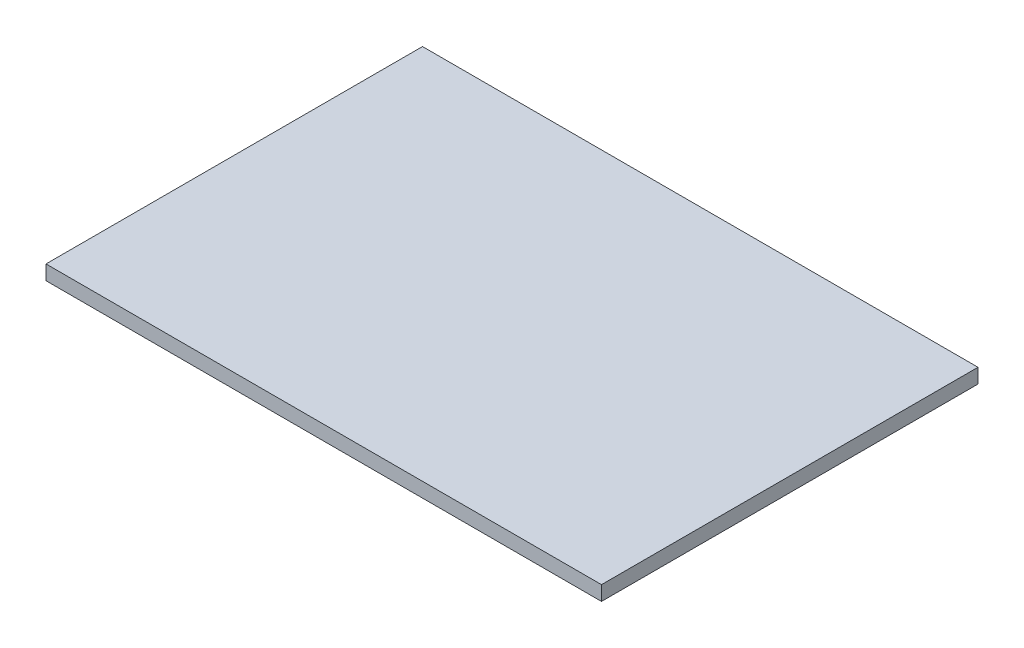
from build123d import *

# Parameters (mm, degrees)
SKETCH1_W           = 90
SKETCH1_H           = 61
BOSS_EXTRUDE1_DEPTH = 1.18


with BuildPart() as part:
    # Sketch1 → Boss-Extrude1 (new, symmetric)
    with BuildSketch(Plane(origin=(0, 0, 0), x_dir=(1, 0, 0), z_dir=(0, 1, 0))):
        Rectangle(SKETCH1_W, SKETCH1_H)
    extrude(amount=BOSS_EXTRUDE1_DEPTH, both=True)


solid = part.part
